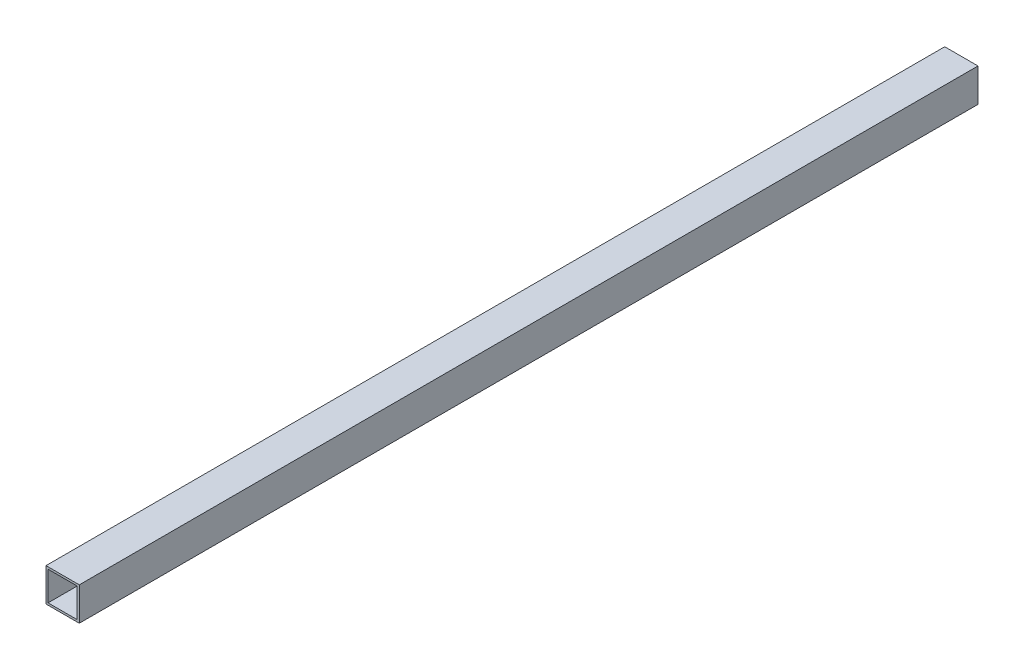
from build123d import *

# Parameters (mm, degrees)
SKETCH1_W           = 25.4
SKETCH1_H           = 25.4
BOSS_EXTRUDE1_DEPTH = 342.9
SHELL1_T            = -1.5875


with BuildPart() as part:
    # Sketch1 → Boss-Extrude1 (new, symmetric)
    with BuildSketch(Plane.XY):
        Rectangle(SKETCH1_W, SKETCH1_H)
    extrude(amount=BOSS_EXTRUDE1_DEPTH, both=True)

    # Shell1
    shell1_openings = [part.faces().sort_by_distance(p)[0] for p in [
        (0, 0, -342.9),
        (0, 0, 342.9),
    ]]
    offset(amount=SHELL1_T, openings=shell1_openings, kind=Kind.INTERSECTION)


solid = part.part
